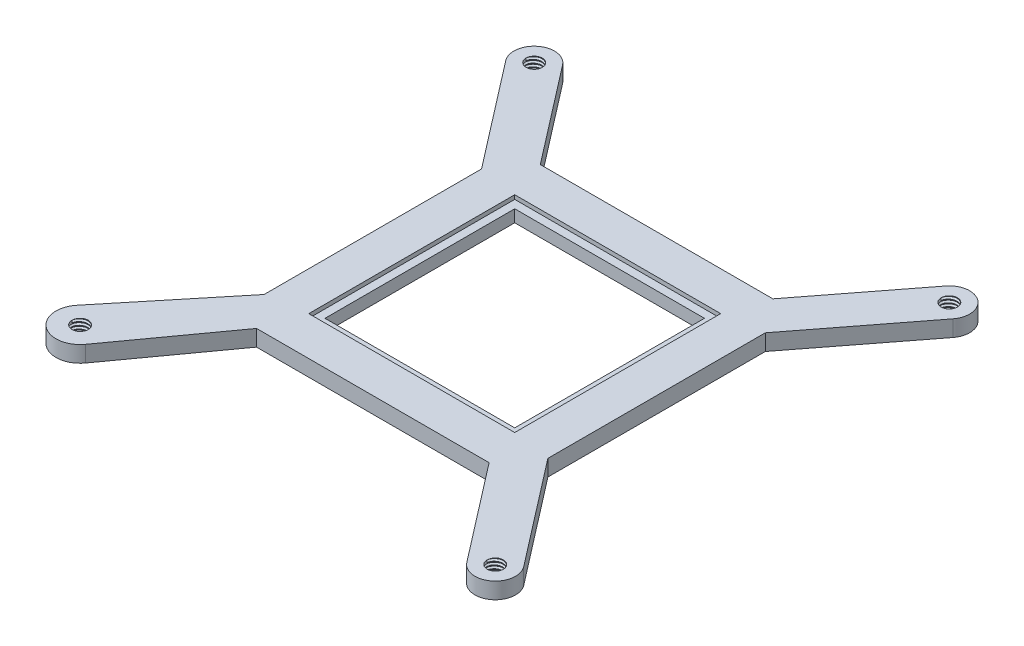
from build123d import *

# Parameters (mm, degrees)
SKETCH1_R           = 1
SKETCH1_W           = 23.4
SKETCH1_H           = 23.4
BOSS_EXTRUDE2_DEPTH = 2
SKETCH13_W          = 25.4
SKETCH13_H          = 25.4
CUT_EXTRUDE1_DEPTH  = 0.5
THREAD5_PITCH       = 0.4
THREAD6_PITCH       = 0.4
THREAD7_PITCH       = 0.4
THREAD8_PITCH       = 0.4


with BuildPart() as part:
    # Sketch1 → Boss-Extrude2 (new body)
    with BuildSketch(Plane(origin=(0, 0, 0), x_dir=(1, 0, 0), z_dir=(0, 1, 0))):
        with BuildLine():
            Line((-13.538768802, 19.20835443), (15.143797468, 19.20835443))
            Line((15.143797468, 19.20835443), (24.424442861, 31.235683419))
            ThreePointArc((24.424442861, 31.235683419), (27.931008557, 31.687800007), (28.383334008, 28.181261247))
            Line((28.383334008, 28.181261247), (18.303797468, 15.115384781))
            Line((18.303797468, 15.115384781), (18.303797468, -11.70164557))
            Line((18.303797468, -11.70164557), (28.384662453, -24.762770137))
            ThreePointArc((28.384662453, -24.762770137), (27.932413942, -28.272710398), (24.422532831, -27.820003059))
            Line((24.422532831, -27.820003059), (15.143797468, -15.79164557))
            Line((15.143797468, -15.79164557), (-13.538768802, -15.79164557))
            Line((-13.538768802, -15.79164557), (-22.384564255, -28.034167211))
            ThreePointArc((-22.384564255, -28.034167211), (-26.610703573, -28.649603758), (-27.098333046, -24.406817741))
            Line((-27.098333046, -24.406817741), (-16.696202532, -11.70164557))
            Line((-16.696202532, -11.70164557), (-16.696202532, 15.115384781))
            Line((-16.696202532, 15.115384781), (-26.775658171, 28.181345795))
            ThreePointArc((-26.775658171, 28.181345795), (-26.323211167, 31.687810069), (-22.816746893, 31.235363066))
            Line((-22.816746893, 31.235363066), (-13.538768802, 19.20835443))
        make_face()
        with Locations(Location((-24.796202532, 29.70835443, 0), (0, 0, 270))):
            Circle(SKETCH1_R, mode=Mode.SUBTRACT)
        with Locations(Location((26.403797468, 29.70835443, 0), (0, 0, 270))):
            Circle(SKETCH1_R, mode=Mode.SUBTRACT)
        with Locations(Location((26.403797468, -26.29164557, 0), (0, 0, 270))):
            Circle(SKETCH1_R, mode=Mode.SUBTRACT)
        with Locations(Location((-24.796202532, -26.29164557, 0), (0, 0, 270))):
            Circle(SKETCH1_R, mode=Mode.SUBTRACT)
        with Locations((0.803797468, 1.70835443)):
            Rectangle(SKETCH1_W, SKETCH1_H, mode=Mode.SUBTRACT)
    extrude(amount=BOSS_EXTRUDE2_DEPTH)

    # Sketch13 → Cut-Extrude1 (cut)
    with BuildSketch(Plane(origin=(0, 2, 0), x_dir=(1, 0, 0), z_dir=(0, 1, 0))):
        with Locations((0.803797468, 1.70835443)):
            Rectangle(SKETCH13_W, SKETCH13_H)
    extrude(amount=-CUT_EXTRUDE1_DEPTH, mode=Mode.SUBTRACT)

    # Thread5: arcs per turn and ends read off the stored shape
    # Thread5: the profile of Thread Profile5 profile screwed along a right-hand helix through 5 turns, 6 arcs to a turn; built about Z, then put on its axis
    thread5_z = Axis((0, 0, 0), (0, 0, 1))
    thread5_corners = [(0.9997, 0, -0.000173205), (1.21650635, 0, 0.124999999), (1.21650635, 0, 0.174999999), (0.9997, 0, 0.300173204)]
    with BuildLine(mode=Mode.PRIVATE) as thread5_profile:
        Line(thread5_corners[0], thread5_corners[1])
        Line(thread5_corners[1], thread5_corners[2])
        Line(thread5_corners[2], thread5_corners[3])
        Line(thread5_corners[3], thread5_corners[0])
    thread5_cap = Face(thread5_profile.wire())
    thread5_turn_angles = [0, 30, 60, 90, 120, 150, 180, 210, 240, 270, 300, 330, 360]
    thread5_turn_weights = [1, 0.8660254037844387, 1, 0.8660254037844387, 1, 0.8660254037844387, 1, 0.8660254037844387, 1, 0.8660254037844387, 1, 0.8660254037844387, 1]
    thread5_turn_rails = [Edge.make_bspline([Vector(p[0], p[1], 0).rotate(thread5_z, thread5_turn_angles[k]) / thread5_turn_weights[k] + Vector(0, 0, p[2] + THREAD5_PITCH * thread5_turn_angles[k] / 360) for k in range(13)], [0, 0, 0, 1, 1, 2, 2, 3, 3, 4, 4, 5, 5, 6, 6, 6], 2, thread5_turn_weights) for p in thread5_corners]
    thread5_turn_sides = [Face.make_surface_from_curves(thread5_turn_rails[p[0]], thread5_turn_rails[p[1]]) for p in [(0, 1), (1, 2), (2, 3), (3, 0)]]
    thread5 = Plane(origin=(-24.796202532, 2, -29.70835443), x_dir=(-1, 0, 0), z_dir=(0, -1, 0)) * Solid(Shell([*[p.moved(Location((0, 0, THREAD5_PITCH * i))) for i in range(5) for p in thread5_turn_sides], thread5_cap, thread5_cap.rotate(thread5_z, 1800).moved(Location((0, 0, THREAD5_PITCH * 1800 / 360)))]))
    add(thread5, mode=Mode.SUBTRACT)

    # Thread6: arcs per turn and ends read off the stored shape
    # Thread6: the profile of Thread Profile6 profile screwed along a right-hand helix through 5 turns, 6 arcs to a turn; built about Z, then put on its axis
    thread6_z = Axis((0, 0, 0), (0, 0, 1))
    thread6_corners = [(0.9997, 0, -0.000173205), (1.21650635, 0, 0.124999999), (1.21650635, 0, 0.174999999), (0.9997, 0, 0.300173204)]
    with BuildLine(mode=Mode.PRIVATE) as thread6_profile:
        Line(thread6_corners[0], thread6_corners[1])
        Line(thread6_corners[1], thread6_corners[2])
        Line(thread6_corners[2], thread6_corners[3])
        Line(thread6_corners[3], thread6_corners[0])
    thread6_cap = Face(thread6_profile.wire())
    thread6_turn_angles = [0, 30, 60, 90, 120, 150, 180, 210, 240, 270, 300, 330, 360]
    thread6_turn_weights = [1, 0.8660254037844387, 1, 0.8660254037844387, 1, 0.8660254037844387, 1, 0.8660254037844387, 1, 0.8660254037844387, 1, 0.8660254037844387, 1]
    thread6_turn_rails = [Edge.make_bspline([Vector(p[0], p[1], 0).rotate(thread6_z, thread6_turn_angles[k]) / thread6_turn_weights[k] + Vector(0, 0, p[2] + THREAD6_PITCH * thread6_turn_angles[k] / 360) for k in range(13)], [0, 0, 0, 1, 1, 2, 2, 3, 3, 4, 4, 5, 5, 6, 6, 6], 2, thread6_turn_weights) for p in thread6_corners]
    thread6_turn_sides = [Face.make_surface_from_curves(thread6_turn_rails[p[0]], thread6_turn_rails[p[1]]) for p in [(0, 1), (1, 2), (2, 3), (3, 0)]]
    thread6 = Plane(origin=(26.403797468, 2, -29.70835443), x_dir=(-1, 0, 0), z_dir=(0, -1, 0)) * Solid(Shell([*[p.moved(Location((0, 0, THREAD6_PITCH * i))) for i in range(5) for p in thread6_turn_sides], thread6_cap, thread6_cap.rotate(thread6_z, 1800).moved(Location((0, 0, THREAD6_PITCH * 1800 / 360)))]))
    add(thread6, mode=Mode.SUBTRACT)

    # Thread7: arcs per turn and ends read off the stored shape
    # Thread7: the profile of Thread Profile7 profile screwed along a right-hand helix through 5 turns, 6 arcs to a turn; built about Z, then put on its axis
    thread7_z = Axis((0, 0, 0), (0, 0, 1))
    thread7_corners = [(0.9997, 0, -0.000173205), (1.21650635, 0, 0.124999999), (1.21650635, 0, 0.174999999), (0.9997, 0, 0.300173204)]
    with BuildLine(mode=Mode.PRIVATE) as thread7_profile:
        Line(thread7_corners[0], thread7_corners[1])
        Line(thread7_corners[1], thread7_corners[2])
        Line(thread7_corners[2], thread7_corners[3])
        Line(thread7_corners[3], thread7_corners[0])
    thread7_cap = Face(thread7_profile.wire())
    thread7_turn_angles = [0, 30, 60, 90, 120, 150, 180, 210, 240, 270, 300, 330, 360]
    thread7_turn_weights = [1, 0.8660254037844387, 1, 0.8660254037844387, 1, 0.8660254037844387, 1, 0.8660254037844387, 1, 0.8660254037844387, 1, 0.8660254037844387, 1]
    thread7_turn_rails = [Edge.make_bspline([Vector(p[0], p[1], 0).rotate(thread7_z, thread7_turn_angles[k]) / thread7_turn_weights[k] + Vector(0, 0, p[2] + THREAD7_PITCH * thread7_turn_angles[k] / 360) for k in range(13)], [0, 0, 0, 1, 1, 2, 2, 3, 3, 4, 4, 5, 5, 6, 6, 6], 2, thread7_turn_weights) for p in thread7_corners]
    thread7_turn_sides = [Face.make_surface_from_curves(thread7_turn_rails[p[0]], thread7_turn_rails[p[1]]) for p in [(0, 1), (1, 2), (2, 3), (3, 0)]]
    thread7 = Plane(origin=(-24.796202532, 2, 26.29164557), x_dir=(-1, 0, 0), z_dir=(0, -1, 0)) * Solid(Shell([*[p.moved(Location((0, 0, THREAD7_PITCH * i))) for i in range(5) for p in thread7_turn_sides], thread7_cap, thread7_cap.rotate(thread7_z, 1800).moved(Location((0, 0, THREAD7_PITCH * 1800 / 360)))]))
    add(thread7, mode=Mode.SUBTRACT)

    # Thread8: arcs per turn and ends read off the stored shape
    # Thread8: the profile of Thread Profile8 profile screwed along a right-hand helix through 5 turns, 6 arcs to a turn; built about Z, then put on its axis
    thread8_z = Axis((0, 0, 0), (0, 0, 1))
    thread8_corners = [(0.9997, 0, -0.000173205), (1.21650635, 0, 0.124999999), (1.21650635, 0, 0.174999999), (0.9997, 0, 0.300173204)]
    with BuildLine(mode=Mode.PRIVATE) as thread8_profile:
        Line(thread8_corners[0], thread8_corners[1])
        Line(thread8_corners[1], thread8_corners[2])
        Line(thread8_corners[2], thread8_corners[3])
        Line(thread8_corners[3], thread8_corners[0])
    thread8_cap = Face(thread8_profile.wire())
    thread8_turn_angles = [0, 30, 60, 90, 120, 150, 180, 210, 240, 270, 300, 330, 360]
    thread8_turn_weights = [1, 0.8660254037844387, 1, 0.8660254037844387, 1, 0.8660254037844387, 1, 0.8660254037844387, 1, 0.8660254037844387, 1, 0.8660254037844387, 1]
    thread8_turn_rails = [Edge.make_bspline([Vector(p[0], p[1], 0).rotate(thread8_z, thread8_turn_angles[k]) / thread8_turn_weights[k] + Vector(0, 0, p[2] + THREAD8_PITCH * thread8_turn_angles[k] / 360) for k in range(13)], [0, 0, 0, 1, 1, 2, 2, 3, 3, 4, 4, 5, 5, 6, 6, 6], 2, thread8_turn_weights) for p in thread8_corners]
    thread8_turn_sides = [Face.make_surface_from_curves(thread8_turn_rails[p[0]], thread8_turn_rails[p[1]]) for p in [(0, 1), (1, 2), (2, 3), (3, 0)]]
    thread8 = Plane(origin=(26.403797468, 2, 26.29164557), x_dir=(-1, 0, 0), z_dir=(0, -1, 0)) * Solid(Shell([*[p.moved(Location((0, 0, THREAD8_PITCH * i))) for i in range(5) for p in thread8_turn_sides], thread8_cap, thread8_cap.rotate(thread8_z, 1800).moved(Location((0, 0, THREAD8_PITCH * 1800 / 360)))]))
    add(thread8, mode=Mode.SUBTRACT)


solid = part.part
